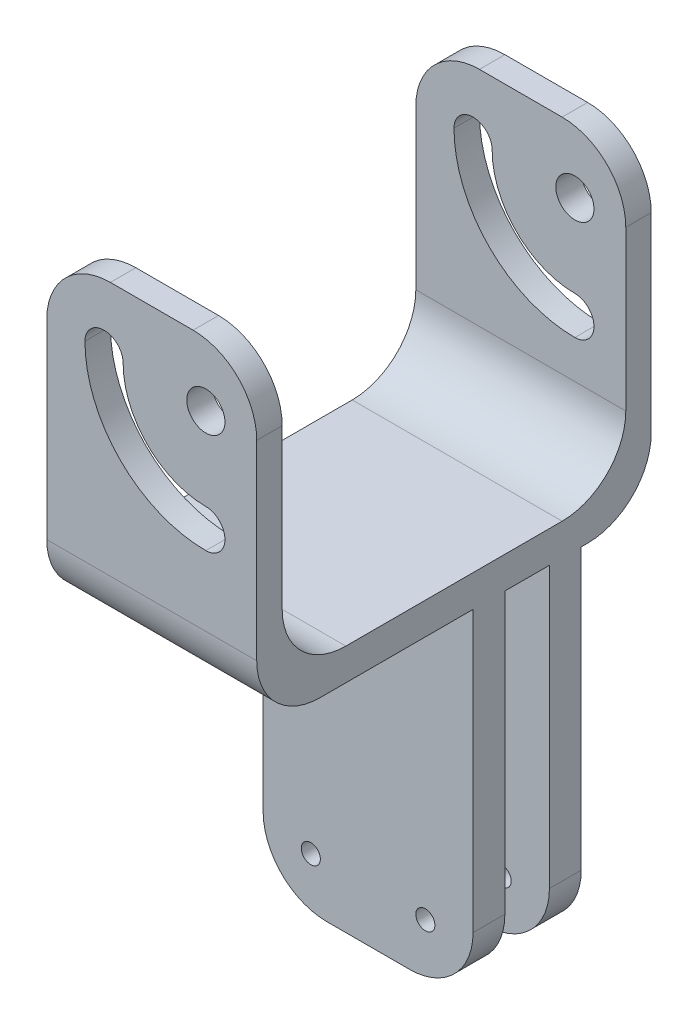
from build123d import *

# Parameters (mm, degrees)
ESBO_O1_W                = 33
ESBO_O1_H                = 50
ESBO_O1_R                = 3
RESSALTO_EXTRUS_O2_DEPTH = 62
ESBO_O3_W                = 33
ESBO_O3_H                = 54
CORTE_EXTRUS_O1_DEPTH    = 45
ESBO_O7_W                = 33
ESBO_O7_H                = 5
RESSALTO_EXTRUS_O3_DEPTH = 54
ESBO_O10_R               = 1.5
CORTE_EXTRUS_O2_DEPTH    = 82.277303105
FILETE1_R                = 10


with BuildPart() as part:
    # Esboço1 → Ressalto-extrusão2 (new body)
    with BuildSketch(Plane.XY):
        with Locations((16.5, 25)):
            Rectangle(ESBO_O1_W, ESBO_O1_H)
        with Locations((25, 40)):
            Circle(ESBO_O1_R, mode=Mode.SUBTRACT)
        with BuildLine():
            ThreePointArc((6, 40), (11.564971157, 26.564971157), (25, 21))
            ThreePointArc((25, 21), (28, 24), (25, 27))
            ThreePointArc((25, 27), (15.807611845, 30.807611845), (12, 40))
            ThreePointArc((12, 40), (9, 43), (6, 40))
        make_face(mode=Mode.SUBTRACT)
    extrude(amount=RESSALTO_EXTRUS_O2_DEPTH)

    # Esboço3 → Corte-extrusão1 (cut)
    with BuildSketch(Plane(origin=(0, 50, 0), x_dir=(1, 0, 0), z_dir=(0, 1, 0))):
        with Locations((16.5, -31)):
            Rectangle(ESBO_O3_W, ESBO_O3_H)
    extrude(amount=-CORTE_EXTRUS_O1_DEPTH, mode=Mode.SUBTRACT)

    # Esboço7 → Ressalto-extrusão3 (add)
    with BuildSketch(Plane.XZ):
        with Locations((16.5, 13.5)):
            Rectangle(ESBO_O7_W, ESBO_O7_H)
        with Locations((16.5, 25.5)):
            Rectangle(ESBO_O7_W, ESBO_O7_H)
    extrude(amount=RESSALTO_EXTRUS_O3_DEPTH)

    # Esboço10 → Corte-extrusão2 (cut, through all)
    with BuildSketch(Plane(origin=(0, 0, 11), x_dir=(-1, 0, 0), z_dir=(0, 0, -1))):
        with Locations((-25.5, -46)):
            Circle(ESBO_O10_R)
        with Locations((-7.5, -46)):
            Circle(ESBO_O10_R)
    extrude(amount=-CORTE_EXTRUS_O2_DEPTH, mode=Mode.SUBTRACT)

    # Filete1
    filete1_edges = [part.edges().sort_by_distance(p)[0] for p in [
        (16.5, 5, 4),
        (0, 50, 2),
        (33, 50, 2),
        (16.5, 5, 58),
        (16.5, 0, 62),
        (16.5, 0, 0),
        (0, 50, 60),
        (33, 50, 60),
        (33, -54, 13.5),
        (0, -54, 13.5),
        (33, -54, 25.5),
        (0, -54, 25.5),
    ]]
    fillet(filete1_edges, radius=FILETE1_R)


solid = part.part
